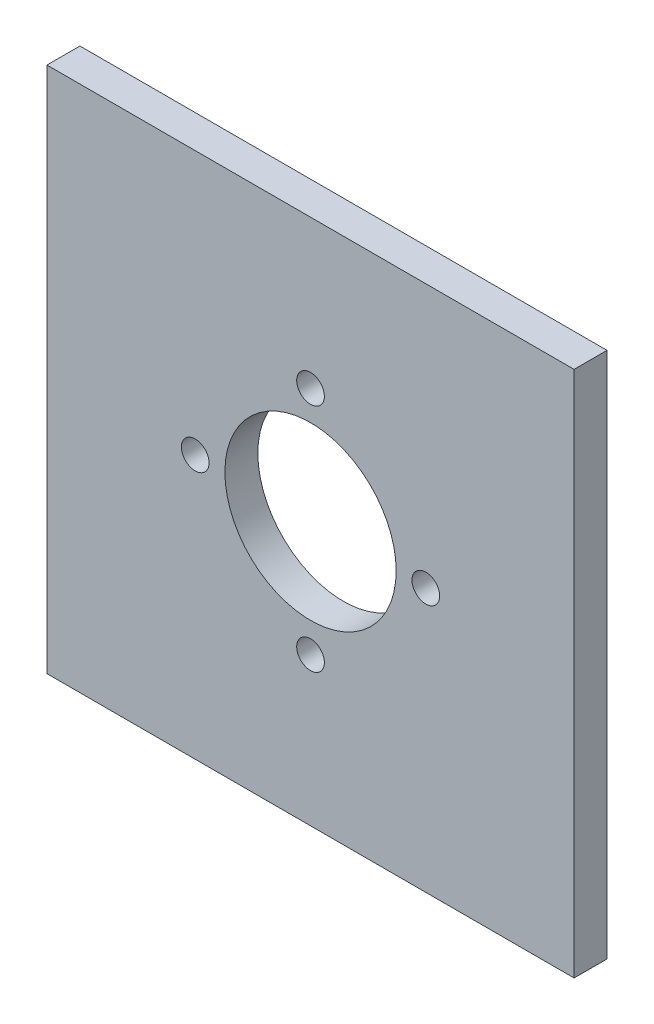
from build123d import *

# Parameters (mm, degrees)
SKETCH_1_W          = 80
SKETCH_1_H          = 80
SKETCH_1_R          = 13
EXTRUDE_1_DEPTH     = 5
SKETCH_2_R          = 2.1
CUT_EXTRUDE_1_DEPTH = 5


with BuildPart() as part:
    # 草图1 → 凸台-拉伸1 (new body)
    with BuildSketch(Plane.XY):
        Rectangle(SKETCH_1_W, SKETCH_1_H)
        Circle(SKETCH_1_R, mode=Mode.SUBTRACT)
    extrude(amount=EXTRUDE_1_DEPTH)

    # 草图2 → 切除-拉伸1 (cut)
    with BuildSketch(Plane.XY.offset(5)):
        with Locations((0, 17.5)):
            Circle(SKETCH_2_R)
        with Locations((17.5, 0)):
            Circle(SKETCH_2_R)
        with Locations((-17.5, 0)):
            Circle(SKETCH_2_R)
        with Locations((0, -17.5)):
            Circle(SKETCH_2_R)
    extrude(amount=-CUT_EXTRUDE_1_DEPTH, mode=Mode.SUBTRACT)


solid = part.part
